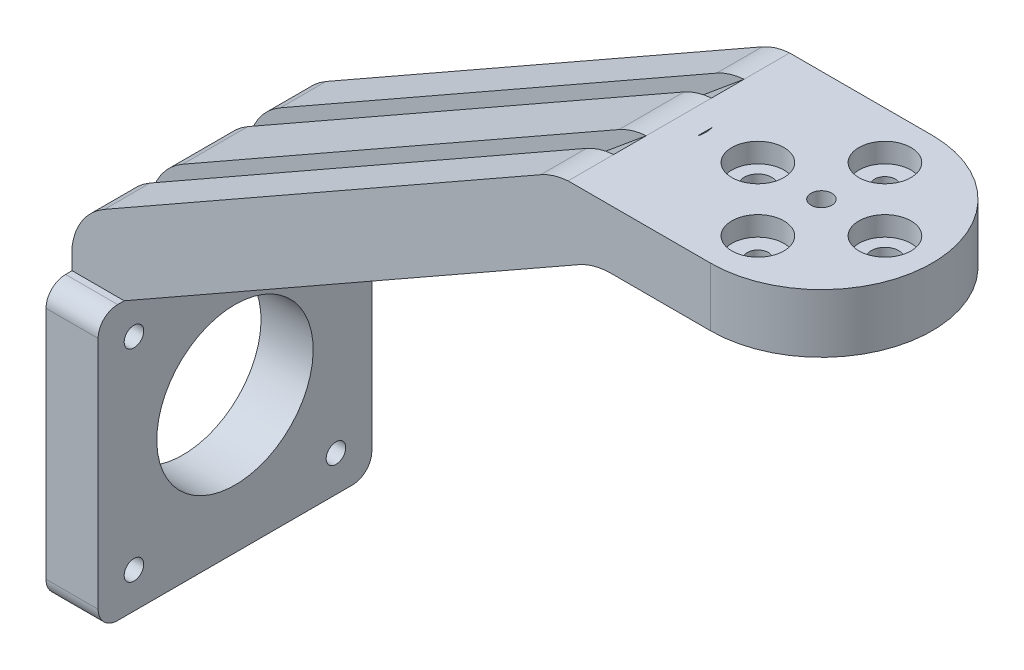
from build123d import *

# Parameters (mm, degrees)
SKETCH_1_R           = 1.6
SKETCH_1_R_2         = 2.1
EXTRUDE_2_DEPTH      = 9
SKETCH_3_R           = 4
CUT_EXTRUDE_2_DEPTH  = 3
SKETCH_4_W           = 22.834782432
SKETCH_4_H           = 34.021608207
CUT_EXTRUDE_3_DEPTH  = 10
SKETCH_5_W           = 8
SKETCH_5_H           = 34
SKETCH_5_R           = 1.6
EXTRUDE_3_DEPTH      = 6
SKETCH_6_R           = 3.5
CUT_EXTRUDE_4_DEPTH  = 3
CUT_EXTRUDE_5_DEPTH  = 13
EXTRUDE_4_DEPTH      = 35
CUT_EXTRUDE_6_DEPTH  = 40
SKETCH_10_W          = 118.393769374
SKETCH_10_H          = 1
CUT_EXTRUDE_7_DEPTH  = 40
SKETCH_11_W          = 80.430163382
SKETCH_11_H          = 7.146133908
CUT_EXTRUDE_8_DEPTH  = 40
EXTRUDE_5_DEPTH      = 34
SKETCH_14_W          = 42
SKETCH_14_H          = 42
EXTRUDE_6_DEPTH      = 8
SKETCH_13_R          = 1.5
SKETCH_13_R_2        = 12
CUT_EXTRUDE_10_DEPTH = 8
SKETCH_15_W          = 89.303663432
SKETCH_15_H          = 7
SKETCH_15_H_2        = 10
EXTRUDE_7_DEPTH      = 4
FILLET_1_R           = 10
FILLET_2_R           = 10
FILLET_3_R           = 3


with BuildPart() as part:
    # 草图1 → 凸台-拉伸2 (new body)
    with BuildSketch(Plane(origin=(0, 0, 0), x_dir=(1, 0, 0), z_dir=(0, 1, 0))):
        with BuildLine():
            Line((0, 17), (90, 17))
            ThreePointArc((90, 17), (107, 0), (90, -17))
            Line((90, -17), (0, -17))
            ThreePointArc((0, -17), (-17, 0), (0, 17))
        make_face()
        with Locations(Location((90, 0, 0), (0, 0, 270))):
            Circle(SKETCH_1_R, mode=Mode.SUBTRACT)
        with Locations(Location((90, 9.75, 0), (0, 0, 270))):
            Circle(SKETCH_1_R, mode=Mode.SUBTRACT)
        with Locations(Location((99.75, 0, 0), (0, 0, 270))):
            Circle(SKETCH_1_R_2, mode=Mode.SUBTRACT)
        with Locations(Location((90, -9.75, 0), (0, 0, 270))):
            Circle(SKETCH_1_R, mode=Mode.SUBTRACT)
        with Locations(Location((80.25, 0, 0), (0, 0, 270))):
            Circle(SKETCH_1_R_2, mode=Mode.SUBTRACT)
    extrude(amount=EXTRUDE_2_DEPTH)

    # 草图3 → 切除-拉伸2 (cut)
    with BuildSketch(Plane(origin=(0, 9, 0), x_dir=(1, 0, 0), z_dir=(0, 1, 0))):
        with Locations(Location((90, 9.75, 0), (0, 0, 270))):
            Circle(SKETCH_3_R)
        with Locations(Location((99.75, 0, 0), (0, 0, 270))):
            Circle(SKETCH_3_R)
        with Locations(Location((90, -9.75, 0), (0, 0, 270))):
            Circle(SKETCH_3_R)
        with Locations(Location((80.25, 0, 0), (0, 0, 270))):
            Circle(SKETCH_3_R)
    extrude(amount=-CUT_EXTRUDE_2_DEPTH, mode=Mode.SUBTRACT)

    # 草图4 → 切除-拉伸3 (cut)
    with BuildSketch(Plane(origin=(0, 9, 0), x_dir=(1, 0, 0), z_dir=(0, 1, 0))):
        with Locations((-11.417391216, 0.010804103)):
            Rectangle(SKETCH_4_W, SKETCH_4_H)
    extrude(amount=-CUT_EXTRUDE_3_DEPTH, mode=Mode.SUBTRACT)

    # 草图5 → 凸台-拉伸3 (add)
    with BuildSketch(Plane(origin=(0, 9, 0), x_dir=(1, 0, 0), z_dir=(0, 1, 0))):
        with Locations((-4, 0)):
            Rectangle(SKETCH_5_W, SKETCH_5_H)
        with Locations(Location((-4, 10, 0), (0, 0, 270))):
            Circle(SKETCH_5_R, mode=Mode.SUBTRACT)
        with Locations(Location((-4, 0, 0), (0, 0, 270))):
            Circle(SKETCH_5_R, mode=Mode.SUBTRACT)
        with Locations(Location((-4, -10, 0), (0, 0, 270))):
            Circle(SKETCH_5_R, mode=Mode.SUBTRACT)
    extrude(amount=-EXTRUDE_3_DEPTH)

    # 草图6 → 切除-拉伸4 (cut)
    with BuildSketch(Plane(origin=(0, 9, 0), x_dir=(1, 0, 0), z_dir=(0, 1, 0))):
        with Locations(Location((-4, 10, 0), (0, 0, 270))):
            Circle(SKETCH_6_R)
        with Locations(Location((-4, 0, 0), (0, 0, 270))):
            Circle(SKETCH_6_R)
        with Locations(Location((-4, -10, 0), (0, 0, 270))):
            Circle(SKETCH_6_R)
    extrude(amount=-CUT_EXTRUDE_4_DEPTH, mode=Mode.SUBTRACT)

    # 草图7 → 切除-拉伸5 (cut)
    with BuildSketch(Plane(origin=(0, 9, 0), x_dir=(1, 0, 0), z_dir=(0, 1, 0))):
        with BuildLine():
            Line((68.25, -4), (7, -4))
            ThreePointArc((7, -4), (3, 0), (7, 4))
            Line((7, 4), (68.25, 4))
            ThreePointArc((68.25, 4), (72.25, 0), (68.25, -4))
        make_face()
    extrude(amount=-CUT_EXTRUDE_5_DEPTH, mode=Mode.SUBTRACT)

    # 草图8 → 凸台-拉伸4 (add)
    with BuildSketch(Plane.XY.offset(17)):
        Polygon((0, -83), (0, -41), (72.080145507, 0), (58.442959142, 0), (-8, -37.793504795), (-8, -41), (-8, -83), align=None)
    extrude(amount=-EXTRUDE_4_DEPTH)

    # 草图9 → 切除-拉伸6 (cut)
    with BuildSketch(Plane.XY.offset(17)):
        Polygon((58.442959142, 0), (68.123155874, 9), (-8, 9), (-8, 0), align=None)
    extrude(amount=-CUT_EXTRUDE_6_DEPTH, mode=Mode.SUBTRACT)

    # 草图10 → 切除-拉伸7 (cut)
    with BuildSketch(Plane(origin=(27.096230432, -29.144093474, 0), x_dir=(0.7323691027025148, 0.6809078479550029, 0), z_dir=(-0.6809078479550029, 0.7323691027025148, 0))):
        with Locations((-3.177419515, 17.5)):
            Rectangle(SKETCH_10_W, SKETCH_10_H)
    extrude(amount=-CUT_EXTRUDE_7_DEPTH, mode=Mode.SUBTRACT)

    # 草图11 → 切除-拉伸8 (cut)
    with BuildSketch(Plane(origin=(17.620285002, -30.977383092, 0), x_dir=(0.8692214499653501, 0.49442296763007937, 0), z_dir=(0.49442296763007937, -0.8692214499653501, 0))):
        with Locations((12.899580295, -20.573066954)):
            Rectangle(SKETCH_11_W, SKETCH_11_H)
    extrude(amount=-CUT_EXTRUDE_8_DEPTH, mode=Mode.SUBTRACT)

    # 草图12 → 凸台-拉伸5 (add)
    with BuildSketch(Plane.XY.offset(17)):
        Polygon((72.080145507, 0), (72.080145507, 9), (68.123155874, 9), (54.780591243, -2.083196181), (58.114256966, -7.94395497), align=None)
    extrude(amount=-EXTRUDE_5_DEPTH)

    # 草图14 → 凸台-拉伸6 (add)
    with BuildSketch(Plane.ZY.offset(8)):
        with Locations((0, -62)):
            Rectangle(SKETCH_14_W, SKETCH_14_H)
    extrude(amount=-EXTRUDE_6_DEPTH)

    # 草图13 → 切除-拉伸10 (cut)
    with BuildSketch(Plane(origin=(0, 0, 0), x_dir=(0, 0, -1), z_dir=(1, 0, 0))):
        with Locations(Location((-15.5, -46.5, 0), (0, 0, 90))):
            Circle(SKETCH_13_R)
        with Locations(Location((15.5, -46.5, 0), (0, 0, 270))):
            Circle(SKETCH_13_R)
        with Locations(Location((15.5, -77.5, 0), (0, 0, 90))):
            Circle(SKETCH_13_R)
        with Locations(Location((-15.5, -77.5, 0), (0, 0, 270))):
            Circle(SKETCH_13_R)
        with Locations(Location((0, -62, 0), (0, 0, 90))):
            Circle(SKETCH_13_R_2)
    extrude(amount=-CUT_EXTRUDE_10_DEPTH, mode=Mode.SUBTRACT)

    # 草图15 → 凸台-拉伸7 (add)
    with BuildSketch(Plane(origin=(14.286619279, -25.116624303, 0), x_dir=(0.86922144996535, 0.4944229676300795, 0), z_dir=(-0.4944229676300795, 0.86922144996535, 0))):
        with Locations((19.012083318, 13.5)):
            Rectangle(SKETCH_15_W, SKETCH_15_H)
        with Locations((19.012083318, 0)):
            Rectangle(SKETCH_15_W, SKETCH_15_H_2)
        with Locations((19.012083318, -13.5)):
            Rectangle(SKETCH_15_W, SKETCH_15_H)
    extrude(amount=EXTRUDE_7_DEPTH)

    # 圆角1
    # the kernel refuses this fillet: 10 mm, written as the material it takes off along each edge
    with BuildSketch(Plane(origin=(67.646967944, 9.837163299, -27.704780935), x_dir=(-0.8692214499653496, -0.4944229676300802, 0), z_dir=(0, 0, 1))) as fillet_1_piece_1:
        with BuildLine():
            CenterArc((4.281912374, 10), FILLET_1_R, 244.647173819, 25.352826181)
            Line((0, 0.963118546), (-0.085638247, 0.782380917))
            ThreePointArc((-0.085638247, 0.782380917), (-0.2, 0.481559273), (-0.2, 0))
            Line((-0.2, 0), (0, -0.2))
            Line((0, -0.2), (4.281912374, -0.2))
            Line((4.281912374, -0.2), (4.281912374, 0))
        make_face()
    extrude(amount=28.40956187, mode=Mode.SUBTRACT)
    with BuildSketch(Plane(origin=(67.646967944, 9.837163299, -15.704780935), x_dir=(-0.8692214499653494, -0.4944229676300803, 0), z_dir=(0, 0, 1))) as fillet_1_piece_2:
        with BuildLine():
            CenterArc((4.281912374, 10), FILLET_1_R, 244.647173819, 25.352826181)
            Line((0, 0.963118546), (-0.085638247, 0.782380917))
            ThreePointArc((-0.085638247, 0.782380917), (-0.2, 0.481559273), (-0.2, 0))
            Line((-0.2, 0), (0, -0.2))
            Line((0, -0.2), (4.281912374, -0.2))
            Line((4.281912374, -0.2), (4.281912374, 0))
        make_face()
    extrude(amount=31.40956187, mode=Mode.SUBTRACT)
    with BuildSketch(Plane(origin=(67.646967944, 9.837163299, 27.704780935), x_dir=(-0.8692214499653496, -0.4944229676300802, 0), z_dir=(0, 0, -1))) as fillet_1_piece_3:
        with BuildLine():
            CenterArc((4.281912374, -10), FILLET_1_R, 90, 25.352826181)
            Line((0, -0.963118546), (-0.085638247, -0.782380917))
            ThreePointArc((-0.085638247, -0.782380917), (-0.2, -0.481559273), (-0.2, 0))
            Line((-0.2, 0), (0, 0.2))
            Line((0, 0.2), (4.281912374, 0.2))
            Line((4.281912374, 0.2), (4.281912374, 0))
        make_face()
    extrude(amount=28.40956187, mode=Mode.SUBTRACT)
    with BuildSketch(Plane(origin=(-9.977691871, -34.316618995, 10), x_dir=(0.49442296763008015, -0.8692214499653496, 0), z_dir=(0, 0, -1))) as fillet_1_piece_4:
        with BuildLine():
            CenterArc((10, -8), FILLET_1_R, 126.869897646, 53.130102354)
            Line((0, -8), (-0.2, -8))
            Line((-0.2, -8), (-0.2, 0))
            Line((-0.2, 0), (0, 0.2))
            ThreePointArc((0, 0.2), (2, 0.2), (3.88, 0.16))
            Line((3.88, 0.16), (4, 0))
        make_face()
    extrude(amount=47, mode=Mode.SUBTRACT)
    with BuildSketch(Plane(origin=(-9.977691871, -34.316618995, 25), x_dir=(0.4944229676300804, -0.8692214499653496, 0), z_dir=(0, 0, -1))) as fillet_1_piece_5:
        with BuildLine():
            CenterArc((10, -8), FILLET_1_R, 126.869897646, 53.130102354)
            Line((0, -8), (-0.2, -8))
            Line((-0.2, -8), (-0.2, 0))
            Line((-0.2, 0), (0, 0.2))
            ThreePointArc((0, 0.2), (2, 0.2), (3.88, 0.16))
            Line((3.88, 0.16), (4, 0))
        make_face()
    extrude(amount=50, mode=Mode.SUBTRACT)
    with BuildSketch(Plane(origin=(-9.977691871, -34.316618995, -10), x_dir=(0.49442296763008015, -0.8692214499653496, 0), z_dir=(0, 0, 1))) as fillet_1_piece_6:
        with BuildLine():
            CenterArc((10, 8), FILLET_1_R, 180, 53.130102354)
            Line((0, 8), (-0.2, 8))
            Line((-0.2, 8), (-0.2, 0))
            Line((-0.2, 0), (0, -0.2))
            ThreePointArc((0, -0.2), (2, -0.2), (3.88, -0.16))
            Line((3.88, -0.16), (4, 0))
        make_face()
    extrude(amount=47, mode=Mode.SUBTRACT)

    # 圆角2
    # the kernel refuses this fillet: 10 mm, written as the material it adds along each edge
    with BuildSketch(Plane(origin=(72.080145507, 0, 17), x_dir=(-0.86922144996535, -0.4944229676300795, 0), z_dir=(0, 0, -1))) as fillet_2_piece_1_section:
        with BuildLine():
            CenterArc((FILLET_2_R * 0.264507433102, -FILLET_2_R), FILLET_2_R, 90, 29.631707367)
            Line((-FILLET_2_R * 0.229915534528, -FILLET_2_R * 0.130778550035), (0, 0))
            Line((0, 0), (FILLET_2_R * 0.264507433102, 0))
        make_face()
    fillet_2_piece_1 = extrude(amount=22.459435899, mode=Mode.PRIVATE)
    fillet_2_piece_1 = split(fillet_2_piece_1, bisect_by=Plane(origin=(72.080145507, -0.43196412, 9.594144242), z_dir=(-1, 0, 0)), keep=Keep.TOP, mode=Mode.PRIVATE)
    add(fillet_2_piece_1)
    with BuildSketch(Plane(origin=(72.080145507, 0, 17), x_dir=(-0.86922144996535, -0.4944229676300795, 0), z_dir=(0, 0, -1))) as fillet_2_piece_2_section:
        with BuildLine():
            CenterArc((FILLET_2_R * 0.264507433102, -FILLET_2_R), FILLET_2_R, 90, 29.631707367)
            Line((-FILLET_2_R * 0.229915534528, -FILLET_2_R * 0.130778550035), (0, 0))
            Line((0, 0), (FILLET_2_R * 0.264507433102, 0))
        make_face()
    fillet_2_piece_2 = extrude(amount=22.459435899, mode=Mode.PRIVATE)
    fillet_2_piece_2 = fillet_2_piece_2 - Plane(origin=(68.25, -0.105711956, 0), x_dir=(0, 0, -1), z_dir=(0, 1, 0)) * Cylinder(4, 56, mode=Mode.PRIVATE)
    add(fillet_2_piece_2)
    with BuildSketch(Plane(origin=(72.080145507, 0, 5.459435899), x_dir=(-0.86922144996535, -0.4944229676300795, 0), z_dir=(0, 0, -1))) as fillet_2_piece_3_section:
        with BuildLine():
            CenterArc((FILLET_2_R * 0.264507433102, -FILLET_2_R), FILLET_2_R, 90, 29.631707367)
            Line((-FILLET_2_R * 0.229915534528, -FILLET_2_R * 0.130778550035), (0, 0))
            Line((0, 0), (FILLET_2_R * 0.264507433102, 0))
        make_face()
    fillet_2_piece_3 = extrude(amount=22.459435899, mode=Mode.PRIVATE)
    fillet_2_piece_3 = split(fillet_2_piece_3, bisect_by=Plane(origin=(72.080145507, -0.402309052, 3.779769442), z_dir=(-1, 0, 0)), keep=Keep.TOP, mode=Mode.PRIVATE)
    add(fillet_2_piece_3)
    with BuildSketch(Plane(origin=(72.080145507, 0, 5.459435899), x_dir=(-0.86922144996535, -0.4944229676300795, 0), z_dir=(0, 0, -1))) as fillet_2_piece_4_section:
        with BuildLine():
            CenterArc((FILLET_2_R * 0.264507433102, -FILLET_2_R), FILLET_2_R, 90, 29.631707367)
            Line((-FILLET_2_R * 0.229915534528, -FILLET_2_R * 0.130778550035), (0, 0))
            Line((0, 0), (FILLET_2_R * 0.264507433102, 0))
        make_face()
    fillet_2_piece_4 = extrude(amount=22.459435899, mode=Mode.PRIVATE)
    fillet_2_piece_4 = fillet_2_piece_4 - Plane(origin=(68.25, -0.105711956, 0), x_dir=(0, 0, -1), z_dir=(0, 1, 0)) * Cylinder(4, 56, mode=Mode.PRIVATE)
    add(fillet_2_piece_4)

    # 圆角3
    fillet_3_edges = [part.edges().sort_by_distance(p)[0] for p in [
        (-4, -83, 21),
        (-4, -41, 21),
        (-4, -83, -21),
        (-4, -41, -21),
    ]]
    fillet(fillet_3_edges, radius=FILLET_3_R)


solid = part.part
